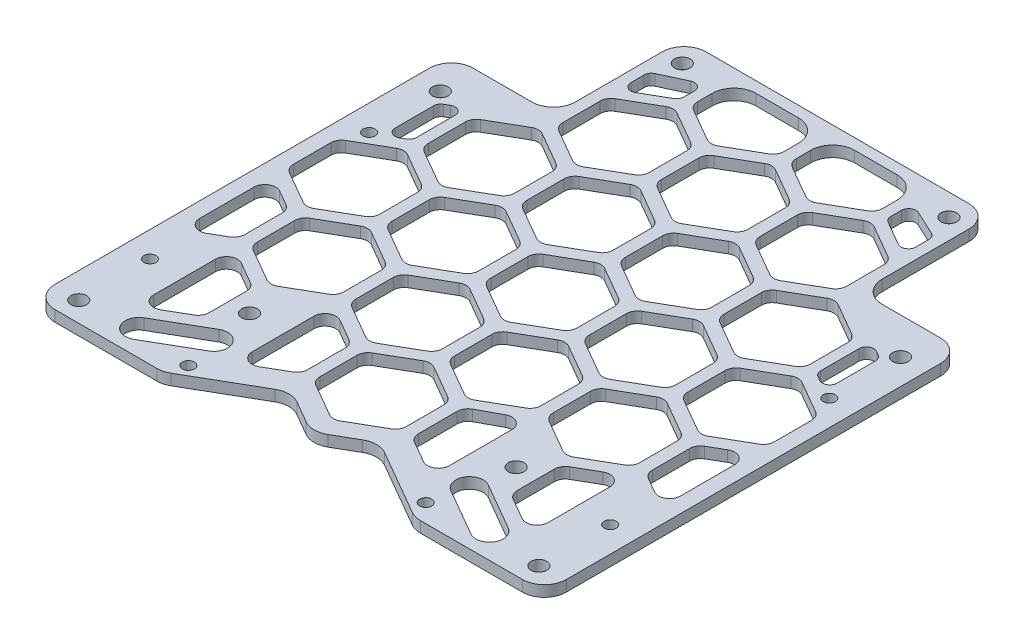
from build123d import *

# Parameters (mm, degrees)
SKETCH_1_R          = 2.15
EXTRUDE_1_DEPTH     = 3
SKETCH_3_R          = 1.65
CUT_EXTRUDE_1_DEPTH = 127.229948903
SKETCH_4_R          = 1.65
CUT_EXTRUDE_2_DEPTH = 127.229948903
SKETCH_5_W          = 23.5
SKETCH_5_H          = 45.5
CUT_EXTRUDE_3_DEPTH = 127.229948903
CUT_EXTRUDE_4_DEPTH = 127.229948903
FILLET_2_R          = 3
CUT_EXTRUDE_6_DEPTH = 127.229948903
SKETCH_10_W         = 84
SKETCH_10_H         = 3
EXTRUDE_2_DEPTH     = 3
FILLET_3_R          = 6
FILLET_4_R          = 2
CUT_EXTRUDE_7_DEPTH = 119.243657335
FILLET_5_R          = 2


with BuildPart() as part:
    # 草图1 → 凸台-拉伸1 (new body)
    with BuildSketch(Plane(origin=(0, 0, 0), x_dir=(1, 0, 0), z_dir=(0, 1, 0))):
        Polygon((-70, 55), (-70, 105), (70, 105), (70, 55), (70, -55), (-70, -55), align=None)
        with Locations(Location((-63, 49.5, 0), (0, 0, 270))):
            Circle(SKETCH_1_R, mode=Mode.SUBTRACT)
        with Locations(Location((63, 49.5, 0), (0, 0, 270))):
            Circle(SKETCH_1_R, mode=Mode.SUBTRACT)
        with Locations(Location((63, -49.5, 0), (0, 0, 270))):
            Circle(SKETCH_1_R, mode=Mode.SUBTRACT)
        with Locations(Location((-63, -49.5, 0), (0, 0, 270))):
            Circle(SKETCH_1_R, mode=Mode.SUBTRACT)
        with Locations(Location((-36.5, 89.25, 0), (0, 0, 270))):
            Circle(SKETCH_1_R, mode=Mode.SUBTRACT)
        with Locations(Location((36.5, 89.25, 0), (0, 0, 270))):
            Circle(SKETCH_1_R, mode=Mode.SUBTRACT)
        with Locations(Location((36.5, -29.25, 0), (0, 0, 270))):
            Circle(SKETCH_1_R, mode=Mode.SUBTRACT)
        with Locations(Location((-36.5, -29.25, 0), (0, 0, 270))):
            Circle(SKETCH_1_R, mode=Mode.SUBTRACT)
    extrude(amount=EXTRUDE_1_DEPTH)

    # 草图3 → 切除-拉伸1 (cut, through all)
    with BuildSketch(Plane(origin=(0, 3, 0), x_dir=(1, 0, 0), z_dir=(0, 1, 0))):
        with Locations(Location((-32.5, -50, 0), (0, 0, 270))):
            Circle(SKETCH_3_R)
        with Locations(Location((32.5, -50, 0), (0, 0, 270))):
            Circle(SKETCH_3_R)
    extrude(amount=-CUT_EXTRUDE_1_DEPTH, mode=Mode.SUBTRACT)

    # 草图4 → 切除-拉伸2 (cut, through all)
    with BuildSketch(Plane(origin=(0, 3, 0), x_dir=(1, 0, 0), z_dir=(0, 1, 0))):
        with Locations(Location((-63, 30, 0), (0, 0, 270))):
            Circle(SKETCH_4_R)
        with Locations(Location((-63, -30, 0), (0, 0, 270))):
            Circle(SKETCH_4_R)
        with Locations(Location((63, -30, 0), (0, 0, 270))):
            Circle(SKETCH_4_R)
        with Locations(Location((63, 30, 0), (0, 0, 270))):
            Circle(SKETCH_4_R)
    extrude(amount=-CUT_EXTRUDE_2_DEPTH, mode=Mode.SUBTRACT)

    # 草图5 → 切除-拉伸3 (cut, through all)
    with BuildSketch(Plane(origin=(0, 3, 0), x_dir=(1, 0, 0), z_dir=(0, 1, 0))):
        with Locations((-58.25, 82.25)):
            Rectangle(SKETCH_5_W, SKETCH_5_H)
        with Locations((58.25, 82.25)):
            Rectangle(SKETCH_5_W, SKETCH_5_H)
    extrude(amount=-CUT_EXTRUDE_3_DEPTH, mode=Mode.SUBTRACT)

    # 草图6 → 切除-拉伸4 (cut, through all)
    with BuildSketch(Plane(origin=(0, 3, 0), x_dir=(1, 0, 0), z_dir=(0, 1, 0))):
        Polygon((-27, 77.654333866), (-38.825, 70.827166933), (-38.825, 57.172833067), (-27, 50.345666134), (-15.175, 57.172833067), (-15.175, 70.827166933), align=None)
        Polygon((-13.5, 101.037019769), (-25.325, 94.209852835), (-25.325, 80.555518969), (-13.5, 73.728352036), (-1.675, 80.555518969), (-1.675, 94.209852835), align=None)
        Polygon((13.5, 101.037019769), (1.675, 94.209852835), (1.675, 80.555518969), (13.5, 73.728352036), (25.325, 80.555518969), (25.325, 94.209852835), align=None)
        Polygon((-40.5, 54.271647964), (-52.325, 47.444481031), (-52.325, 33.790147165), (-40.5, 26.962980231), (-28.675, 33.790147165), (-28.675, 47.444481031), align=None)
        Polygon((-54, 30.884333866), (-65.825, 24.057166933), (-65.825, 10.402833067), (-54, 3.575666134), (-42.175, 10.402833067), (-42.175, 24.057166933), align=None)
        Polygon((-27, 30.884333866), (-38.825, 24.057166933), (-38.825, 10.402833067), (-27, 3.575666134), (-15.175, 10.402833067), (-15.175, 24.057166933), align=None)
        Polygon((0, 30.884333866), (-11.825, 24.057166933), (-11.825, 10.402833067), (0, 3.575666134), (11.825, 10.402833067), (11.825, 24.057166933), align=None)
        Polygon((0, -15.885666134), (-11.825, -22.712833067), (-11.825, -36.367166933), (0, -43.194333866), (11.825, -36.367166933), (11.825, -22.712833067), align=None)
        Polygon((27, 30.884333866), (15.175, 24.057166933), (15.175, 10.402833067), (27, 3.575666134), (38.825, 10.402833067), (38.825, 24.057166933), align=None)
        Polygon((54, 30.884333866), (42.175, 24.057166933), (42.175, 10.402833067), (54, 3.575666134), (65.825, 10.402833067), (65.825, 24.057166933), align=None)
        Polygon((0, 77.654333866), (-11.825, 70.827166933), (-11.825, 57.172833067), (0, 50.345666134), (11.825, 57.172833067), (11.825, 70.827166933), align=None)
        Polygon((27, 77.654333866), (15.175, 70.827166933), (15.175, 57.172833067), (27, 50.345666134), (38.825, 57.172833067), (38.825, 70.827166933), align=None)
        Polygon((-13.5, 54.271647964), (-25.325, 47.444481031), (-25.325, 33.790147165), (-13.5, 26.962980231), (-1.675, 33.790147165), (-1.675, 47.444481031), align=None)
        Polygon((13.5, 54.271647964), (1.675, 47.444481031), (1.675, 33.790147165), (13.5, 26.962980231), (25.325, 33.790147165), (25.325, 47.444481031), align=None)
        Polygon((40.5, 54.271647964), (28.675, 47.444481031), (28.675, 33.790147165), (40.5, 26.962980231), (52.325, 33.790147165), (52.325, 47.444481031), align=None)
        Polygon((-13.499999478, 7.501647964), (-25.324999478, 0.674481031), (-25.324999478, -12.979852835), (-13.499999478, -19.807019769), (-1.674999478, -12.979852835), (-1.674999478, 0.674481031), align=None)
        Polygon((13.500000522, 7.501647964), (1.675000522, 0.674481031), (1.675000522, -12.979852835), (13.500000522, -19.807019769), (25.325000522, -12.979852835), (25.325000522, 0.674481031), align=None)
        Polygon((40.500000522, 7.501647964), (28.675000522, 0.674481031), (28.675000522, -12.979852835), (40.500000522, -19.807019769), (52.325000522, -12.979852835), (52.325000522, 0.674481031), align=None)
        Polygon((-40.499999478, 7.501647964), (-52.324999478, 0.674481031), (-52.324999478, -12.979852835), (-40.499999478, -19.807019769), (-28.674999478, -12.979852835), (-28.674999478, 0.674481031), align=None)
        Polygon((-27, -15.885666134), (-27, -43.194333866), (-15.175, -36.367166933), (-15.175, -22.712833067), align=None)
        Polygon((27, -15.885666134), (27, -43.194333866), (15.175, -36.367166933), (15.175, -22.281892044), align=None)
        Polygon((-54, -15.885666134), (-54, -43.194333866), (-42.175, -36.367166933), (-42.175, -22.712833067), align=None)
        Polygon((54, -15.885666134), (54, -43.194333866), (42.175, -36.367166933), (42.175, -22.712833067), align=None)
        Polygon((55.825000522, 0.674481031), (55.825000522, -12.979852835), (65.825, -18.753355226), (65.825, 6.447983422), align=None)
        Polygon((-65.825, -18.753355226), (-65.825, 6.447983422), (-55.825000522, 0.674481031), (-55.825000522, -12.979852835), align=None)
    extrude(amount=-CUT_EXTRUDE_4_DEPTH, mode=Mode.SUBTRACT)

    # 圆角2
    fillet_2_edges = [part.edges().sort_by_distance(p)[0] for p in [
        (27, 1.5, -30.884333866),
        (38.825, 1.5, -24.057166933),
        (38.825, 1.5, -10.402833067),
        (27, 1.5, -3.575666134),
        (15.175, 1.5, -10.402833067),
        (15.175, 1.5, -24.057166933),
        (0, 1.5, 15.885666134),
        (11.825, 1.5, 22.712833067),
        (11.825, 1.5, 36.367166933),
        (0, 1.5, 43.194333866),
        (-11.825, 1.5, 36.367166933),
        (-11.825, 1.5, 22.712833067),
        (0, 1.5, -30.884333866),
        (11.825, 1.5, -24.057166933),
        (11.825, 1.5, -10.402833067),
        (0, 1.5, -3.575666134),
        (-11.825, 1.5, -10.402833067),
        (-11.825, 1.5, -24.057166933),
        (-27, 1.5, 15.885666134),
        (-15.175, 1.5, 22.712833067),
        (-15.175, 1.5, 36.367166933),
        (-27, 1.5, 43.194333866),
        (54, 1.5, -30.884333866),
        (65.825, 1.5, -24.057166933),
        (65.825, 1.5, -10.402833067),
        (54, 1.5, -3.575666134),
        (42.175, 1.5, -10.402833067),
        (42.175, 1.5, -24.057166933),
        (42.175, 1.5, 22.712833067),
        (54, 1.5, 15.885666134),
        (54, 1.5, 43.194333866),
        (42.175, 1.5, 36.367166933),
        (0, 1.5, -77.654333866),
        (11.825, 1.5, -70.827166933),
        (11.825, 1.5, -57.172833067),
        (0, 1.5, -50.345666134),
        (-11.825, 1.5, -57.172833067),
        (-11.825, 1.5, -70.827166933),
        (27, 1.5, -77.654333866),
        (38.825, 1.5, -70.827166933),
        (38.825, 1.5, -57.172833067),
        (27, 1.5, -50.345666134),
        (15.175, 1.5, -57.172833067),
        (15.175, 1.5, -70.827166933),
        (-40.5, 1.5, -54.271647964),
        (-28.675, 1.5, -47.444481031),
        (-28.675, 1.5, -33.790147165),
        (-40.5, 1.5, -26.962980231),
        (-52.325, 1.5, -33.790147165),
        (-52.325, 1.5, -47.444481031),
        (13.5, 1.5, -101.037019769),
        (25.325, 1.5, -94.209852835),
        (25.325, 1.5, -80.555518969),
        (13.5, 1.5, -73.728352036),
        (1.675, 1.5, -80.555518969),
        (1.675, 1.5, -94.209852835),
        (-13.5, 1.5, -101.037019769),
        (-1.675, 1.5, -94.209852835),
        (-1.675, 1.5, -80.555518969),
        (-13.5, 1.5, -73.728352036),
        (-25.325, 1.5, -80.555518969),
        (-25.325, 1.5, -94.209852835),
        (55.825000522, 1.5, -0.674481031),
        (65.825, 1.5, -6.447983422),
        (65.825, 1.5, 18.753355226),
        (55.825000522, 1.5, 12.979852835),
        (-27, 1.5, -30.884333866),
        (-15.175, 1.5, -24.057166933),
        (-15.175, 1.5, -10.402833067),
        (-27, 1.5, -3.575666134),
        (-38.825, 1.5, -10.402833067),
        (-38.825, 1.5, -24.057166933),
        (-54, 1.5, 15.885666134),
        (-42.175, 1.5, 22.712833067),
        (-42.175, 1.5, 36.367166933),
        (-54, 1.5, 43.194333866),
        (-54, 1.5, -30.884333866),
        (-42.175, 1.5, -24.057166933),
        (-42.175, 1.5, -10.402833067),
        (-54, 1.5, -3.575666134),
        (-65.825, 1.5, -10.402833067),
        (-65.825, 1.5, -24.057166933),
        (15.175, 1.5, 22.281892044),
        (27, 1.5, 15.885666134),
        (27, 1.5, 43.194333866),
        (15.175, 1.5, 36.367166933),
        (-55.825000522, 1.5, 12.979852835),
        (-65.825, 1.5, 18.753355226),
        (-65.825, 1.5, -6.447983422),
        (-55.825000522, 1.5, -0.674481031),
        (-40.499999478, 1.5, -7.501647964),
        (-28.674999478, 1.5, -0.674481031),
        (-28.674999478, 1.5, 12.979852835),
        (-40.499999478, 1.5, 19.807019769),
        (-52.324999478, 1.5, 12.979852835),
        (-52.324999478, 1.5, -0.674481031),
        (40.500000522, 1.5, -7.501647964),
        (52.325000522, 1.5, -0.674481031),
        (52.325000522, 1.5, 12.979852835),
        (40.500000522, 1.5, 19.807019769),
        (28.675000522, 1.5, 12.979852835),
        (28.675000522, 1.5, -0.674481031),
        (13.500000522, 1.5, -7.501647964),
        (25.325000522, 1.5, -0.674481031),
        (25.325000522, 1.5, 12.979852835),
        (13.500000522, 1.5, 19.807019769),
        (1.675000522, 1.5, 12.979852835),
        (1.675000522, 1.5, -0.674481031),
        (-13.5, 1.5, -54.271647964),
        (-1.675, 1.5, -47.444481031),
        (-1.675, 1.5, -33.790147165),
        (-13.5, 1.5, -26.962980231),
        (-25.325, 1.5, -33.790147165),
        (-25.325, 1.5, -47.444481031),
        (13.5, 1.5, -54.271647964),
        (25.325, 1.5, -47.444481031),
        (25.325, 1.5, -33.790147165),
        (13.5, 1.5, -26.962980231),
        (1.675, 1.5, -33.790147165),
        (1.675, 1.5, -47.444481031),
        (40.5, 1.5, -54.271647964),
        (52.325, 1.5, -47.444481031),
        (52.325, 1.5, -33.790147165),
        (40.5, 1.5, -26.962980231),
        (28.675, 1.5, -33.790147165),
        (28.675, 1.5, -47.444481031),
        (-13.499999478, 1.5, -7.501647964),
        (-1.674999478, 1.5, -0.674481031),
        (-1.674999478, 1.5, 12.979852835),
        (-13.499999478, 1.5, 19.807019769),
        (-25.324999478, 1.5, 12.979852835),
        (-25.324999478, 1.5, -0.674481031),
        (-27, 1.5, -77.654333866),
        (-15.175, 1.5, -70.827166933),
        (-15.175, 1.5, -57.172833067),
        (-27, 1.5, -50.345666134),
        (-38.825, 1.5, -57.172833067),
        (-38.825, 1.5, -70.827166933),
    ]]
    fillet(fillet_2_edges, radius=FILLET_2_R)

    # 草图9 → 切除-拉伸6 (cut, through all)
    with BuildSketch(Plane(origin=(0, 3, 0), x_dir=(1, 0, 0), z_dir=(0, 1, 0))):
        Polygon((0, 95.25), (-42, 95.25), (-42, 59.5), (-46.5, 59.5), (-46.5, 105), (0, 105), (46.5, 105), (46.5, 59.5), (42, 59.5), (42, 95.25), align=None)
        Polygon((-34.448013561, -55), (-12, -42.039633328), (0, -48.967836558), (12, -42.039633328), (34.448013561, -55), align=None)
        Polygon((-55.325, 49.312361163), (-55.325, 34.160796644), (-60.5, 31.173009001), (-60.5, 46.324573519), align=None)
        Polygon((60.5, 31.173009001), (60.5, 46.324573519), (55.325, 49.312361163), (55.325, 34.160796644), align=None)
    extrude(amount=-CUT_EXTRUDE_6_DEPTH, mode=Mode.SUBTRACT)

    # 草图10 → 凸台-拉伸2 (add)
    with BuildSketch(Plane(origin=(0, 3, 0), x_dir=(1, 0, 0), z_dir=(0, 1, 0))):
        with Locations((0, 93.75)):
            Rectangle(SKETCH_10_W, SKETCH_10_H)
    extrude(amount=-EXTRUDE_2_DEPTH)

    # 圆角3
    fillet_3_edges = [part.edges().sort_by_distance(p)[0] for p in [
        (70, 1.5, -59.5),
        (70, 1.5, 55),
        (-70, 1.5, 55),
        (42, 1.5, -95.25),
        (42, 1.5, -59.5),
        (-42, 1.5, -95.25),
        (-42, 1.5, -59.5),
        (12, 1.5, 42.039633328),
        (34.448013561, 1.5, 55),
        (-34.448013561, 1.5, 55),
        (-12, 1.5, 42.039633328),
        (0, 1.5, 48.967836558),
        (-1.675, 1.5, -92.25),
        (1.675, 1.5, -92.25),
        (25.325, 1.5, -92.25),
        (-25.325, 1.5, -92.25),
        (-70, 1.5, -59.5),
    ]]
    fillet(fillet_3_edges, radius=FILLET_3_R)

    # 圆角4
    fillet_4_edges = [part.edges().sort_by_distance(p)[0] for p in [
        (-60.5, 1.5, -46.324573519),
        (-55.325, 1.5, -49.312361163),
        (-55.325, 1.5, -34.160796644),
        (-60.5, 1.5, -31.173009001),
        (60.5, 1.5, -31.173009001),
        (55.325, 1.5, -34.160796644),
        (55.325, 1.5, -49.312361163),
        (60.5, 1.5, -46.324573519),
    ]]
    fillet(fillet_4_edges, radius=FILLET_4_R)

    # 草图13 → 切除-拉伸7 (cut, through all)
    with BuildSketch(Plane(origin=(0, 3, 0), x_dir=(1, 0, 0), z_dir=(0, 1, 0))):
        with BuildLine():
            Line((-49.875, -44.752404736), (-36.884618943, -37.252404736))
            ThreePointArc((-36.884618943, -37.252404736), (-31.762023679, -38.625), (-33.134618943, -43.747595264))
            Line((-33.134618943, -43.747595264), (-46.125, -51.247595264))
            ThreePointArc((-46.125, -51.247595264), (-51.247595264, -49.875), (-49.875, -44.752404736))
        make_face()
        with BuildLine():
            Line((49.875, -44.752404736), (36.884618943, -37.252404736))
            ThreePointArc((36.884618943, -37.252404736), (31.762023679, -38.625), (33.134618943, -43.747595264))
            Line((33.134618943, -43.747595264), (46.125, -51.247595264))
            ThreePointArc((46.125, -51.247595264), (51.247595264, -49.875), (49.875, -44.752404736))
        make_face()
        Polygon((-39, 82.56734126), (-39, 74.190232251), (-28.325, 80.353446375), (-28.325, 87.545175511), align=None)
        Polygon((28.325, 80.353446375), (28.325, 87.545175511), (39, 82.56734126), (39, 74.190232251), align=None)
    extrude(amount=-CUT_EXTRUDE_7_DEPTH, mode=Mode.SUBTRACT)

    # 圆角5
    fillet_5_edges = [part.edges().sort_by_distance(p)[0] for p in [
        (-39, 1.5, -82.56734126),
        (-28.325, 1.5, -87.545175511),
        (-28.325, 1.5, -80.353446375),
        (-39, 1.5, -74.190232251),
        (39, 1.5, -74.190232251),
        (28.325, 1.5, -80.353446375),
        (28.325, 1.5, -87.545175511),
        (39, 1.5, -82.56734126),
    ]]
    fillet(fillet_5_edges, radius=FILLET_5_R)


solid = part.part
